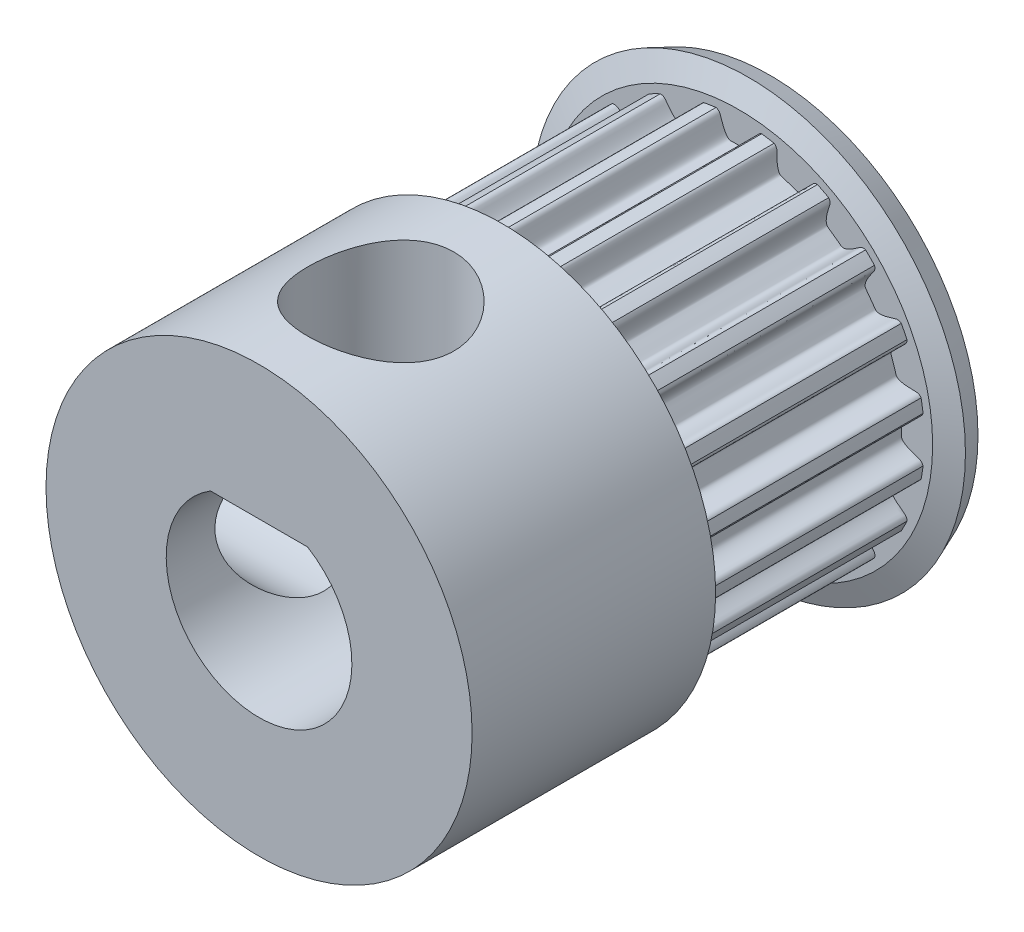
from build123d import *

# Parameters (mm, degrees)
TOOTHEXTRUDECUTGEARBELT01_DEPTH = 3.749999944
TOOTH_PATTERN_20_COUNT          = 20
BOREREVOLVESKETCH_W             = 10.547999842
BOREREVOLVESKETCH_H             = 5
SKETCH_6_R                      = 7.128197617
CUT_EXTRUDE_2_DEPTH             = 14.702955833
SKETCH_7_R                      = 7.128197617
CUT_EXTRUDE_3_DEPTH             = 0.5
SKETCH_8_R                      = 6.998721554
EXTRUDE_2_DEPTH                 = 8
SKETCH_9_R                      = 5
EXTRUDE_3_DEPTH                 = 8.5
SKETCH_10_R                     = 3.05
CUT_EXTRUDE_4_DEPTH             = 20.33578037
EXTRUDE_START                   = -16.5
EXTRUDE_4_DEPTH                 = 16.5
SKETCH_12_R                     = 2.4
CUT_EXTRUDE_6_DEPTH             = 4.5
CUT_EXTRUDE_7_DEPTH             = 16.681535234


with BuildPart() as part:
    # SketchRevolveGearBelt01 → Gates_PowerGrip_GT_2mm, 6mm Belt Width (revolve)
    with BuildSketch(Plane(origin=(0, 0, 0), x_dir=(0, 0, -1), z_dir=(1, 0, 0))):
        Polygon((5.273999921, 0), (5.273999921, 4.866197651), (4.511999932, 4.866197651), (4.511999932, 6.214626406), (4.769626867, 6.836592846), (4.065630673, 7.128197617), (3.749999944, 6.366197628), (3.749999944, 6.097381812), (-3.749999944, 6.097381812), (-3.749999944, 6.366197628), (-4.065630673, 7.128197617), (-4.769626867, 6.836592846), (-4.511999932, 6.214626406), (-4.511999932, 4.866197651), (-5.273999921, 4.866197651), (-5.273999921, 0), align=None)
    revolve(axis=Axis((0, 0, 0), (0, 0, -1)))

    # SketchToothGearBelt01 → ToothExtrudeCutGearBelt01 (cut, symmetric)
    with BuildSketch(Plane.XY):
        with BuildLine():
            ThreePointArc((6.057499697, 0.812101915), (6.1116947, 0), (6.057499697, -0.812101915))
            add(Edge.make_bspline(
                [(6.057499697, -0.812101915), (6.058333892, -0.798636628), (6.05752678, -0.778312876), (6.052390701, -0.751789277), (6.046549263, -0.732387376), (6.038777876, -0.713674757), (6.029156134, -0.695842773), (6.01778237, -0.679074023), (6.004773173, -0.663539298), (5.990260703, -0.649400233), (5.974396793, -0.636791263), (5.957331072, -0.625879395), (5.93928528, -0.616634307), (5.901407836, -0.602783761), (5.851341938, -0.587243165), (5.790886365, -0.567475792), (5.740119979, -0.549822718), (5.692422143, -0.532182602), (5.647797435, -0.514541673), (5.606243662, -0.496903396), (5.56776, -0.479266884), (5.532344907, -0.46163211), (5.499996543, -0.443998471), (5.470712544, -0.426364888), (5.444490091, -0.408729361), (5.421325719, -0.39108843), (5.401216601, -0.373436343), (5.384158786, -0.355764081), (5.370158961, -0.338058507), (5.359207624, -0.320303478), (5.351386789, -0.302483729), (5.346522487, -0.284599108), (5.344349546, -0.250294946), (5.348112416, -0.199977901), (5.348540819, -0.133284358), (5.349542206, -0.066646885), (5.349720908, 0), (5.349542206, 0.066646885), (5.348540819, 0.133284358), (5.348112416, 0.199977901), (5.344349546, 0.250294946), (5.346522487, 0.284599108), (5.351386789, 0.302483729), (5.359207624, 0.320303478), (5.370158961, 0.338058507), (5.384158786, 0.355764081), (5.401216601, 0.373436343), (5.421325719, 0.39108843), (5.444490091, 0.408729361), (5.470712544, 0.426364888), (5.499996543, 0.443998471), (5.532344907, 0.46163211), (5.56776, 0.479266884), (5.606243662, 0.496903396), (5.647797435, 0.514541673), (5.692422143, 0.532182602), (5.740119979, 0.549822718), (5.790886365, 0.567475792), (5.851341938, 0.587243165), (5.901407836, 0.602783761), (5.93928528, 0.616634307), (5.957331072, 0.625879395), (5.974396793, 0.636791263), (5.990260703, 0.649400233), (6.004773173, 0.663539298), (6.01778237, 0.679074023), (6.029156134, 0.695842773), (6.038777876, 0.713674757), (6.046549263, 0.732387376), (6.052390701, 0.751789277), (6.05752678, 0.778312876), (6.058333892, 0.798636628), (6.057499697, 0.812101915)],
                knots=[0, 0, 0, 0, 0.016480534, 0.024720801, 0.032961068, 0.041201335, 0.049441602, 0.057681868, 0.065922135, 0.074162402, 0.082402669, 0.090642936, 0.098883203, 0.10712347, 0.139880128, 0.162959133, 0.184851073, 0.205563721, 0.225106258, 0.243489619, 0.260726943, 0.276834174, 0.291830863, 0.305741243, 0.318595692, 0.33043272, 0.341301658, 0.351266226, 0.36040907, 0.368837047, 0.376686262, 0.384124662, 0.391348897, 0.418550232, 0.445700155, 0.472850077, 0.5, 0.527149923, 0.554299845, 0.581449768, 0.608651103, 0.615875338, 0.623313738, 0.631162953, 0.63959093, 0.648733774, 0.658698342, 0.66956728, 0.681404308, 0.694258757, 0.708169137, 0.723165826, 0.739273057, 0.756510381, 0.774893742, 0.794436279, 0.815148927, 0.837040867, 0.860119872, 0.89287653, 0.901116797, 0.909357064, 0.917597331, 0.925837598, 0.934077865, 0.942318132, 0.950558398, 0.958798665, 0.967038932, 0.975279199, 0.983519466, 1, 1, 1, 1], degree=3))
        make_face()
    toothextrudecutgearbelt01 = extrude(amount=TOOTHEXTRUDECUTGEARBELT01_DEPTH, both=True, mode=Mode.SUBTRACT)

    # Tooth Pattern, 20: ToothExtrudeCutGearBelt01 ×20 about axis
    tooth_pattern_20_axis = Axis((0, 0, 55), (0, 0, -1))
    for i in range(1, TOOTH_PATTERN_20_COUNT):
        add(toothextrudecutgearbelt01.rotate(tooth_pattern_20_axis, i * 360 / TOOTH_PATTERN_20_COUNT), mode=Mode.SUBTRACT)

    # BoreRevolveSketch → BoreRevolveCut (revolve, cut)
    with BuildSketch(Plane(origin=(0, 0, 0), x_dir=(0, 0, -1), z_dir=(1, 0, 0))):
        with Locations((0, 2.5)):
            Rectangle(BOREREVOLVESKETCH_W, BOREREVOLVESKETCH_H)
    revolve(axis=Axis((0, 0, 0), (0, 0, -1)), mode=Mode.SUBTRACT)

    # 草图6 → 切除-拉伸2 (cut, through all)
    with BuildSketch(Plane.XY.offset(4.511999932)):
        Circle(SKETCH_6_R)
    extrude(amount=CUT_EXTRUDE_2_DEPTH, mode=Mode.SUBTRACT)

    # 草图7 → 切除-拉伸3 (cut)
    with BuildSketch(Plane.XY.offset(4.511999932)):
        Circle(SKETCH_7_R)
    extrude(amount=-CUT_EXTRUDE_3_DEPTH, mode=Mode.SUBTRACT)

    # 草图8 → 凸台-拉伸2 (add)
    with BuildSketch(Plane.XY.offset(4.011999932)):
        Circle(SKETCH_8_R)
    extrude(amount=EXTRUDE_2_DEPTH)

    # 草图9 → 凸台-拉伸3 (add)
    with BuildSketch(Plane(origin=(0, 0, 4.011999932), x_dir=(-1, 0, 0), z_dir=(0, 0, -1))):
        Circle(SKETCH_9_R)
    extrude(amount=EXTRUDE_3_DEPTH)

    # 草图10 → 切除-拉伸4 (cut, through all)
    with BuildSketch(Plane(origin=(0, 0, -4.488000068), x_dir=(-1, 0, 0), z_dir=(0, 0, -1))):
        Circle(SKETCH_10_R)
    extrude(amount=-CUT_EXTRUDE_4_DEPTH, mode=Mode.SUBTRACT)

    # 草图11 → 凸台-拉伸4 (add)
    with BuildSketch(Plane.XY.offset(12.011999932).offset(EXTRUDE_START)):
        with BuildLine():
            ThreePointArc((1.594521872, 2.6), (0, 3.05), (-1.594521872, 2.6))
            Line((-1.594521872, 2.6), (0, 2.6))
            Line((0, 2.6), (1.594521872, 2.6))
        make_face()
    extrude(amount=EXTRUDE_4_DEPTH)

    # 草图12 → 切除-拉伸6 (cut, symmetric)
    with BuildSketch(Plane.XZ.offset(-2.6)):
        with Locations((0, 8.011999932)):
            Circle(SKETCH_12_R)
    extrude(amount=CUT_EXTRUDE_6_DEPTH, both=True, mode=Mode.SUBTRACT)

    # 草图13 → 切除-拉伸7 (cut, through all)
    with BuildSketch(Plane(origin=(0, 0, 0), x_dir=(0, 0, -1), z_dir=(1, 0, 0))):
        with BuildLine():
            ThreePointArc((-10.411999932, 0), (-8.011999932, -2.4), (-5.611999932, 0))
            ThreePointArc((-5.611999932, 0), (-8.011999932, 2.4), (-10.411999932, 0))
        make_face()
    extrude(amount=-CUT_EXTRUDE_7_DEPTH, mode=Mode.SUBTRACT)


solid = part.part
